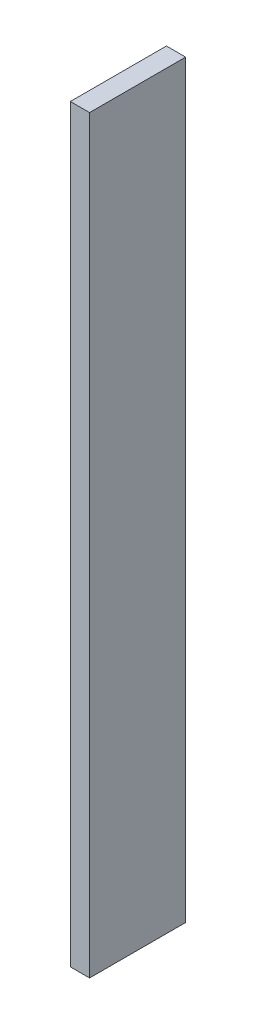
from build123d import *

# Parameters (mm, degrees)
ESQUISSE1_W        = 50
ESQUISSE1_H        = 390
BOSS_EXTRU_1_DEPTH = 10


with BuildPart() as part:
    # Esquisse1 → Boss.-Extru.1 (new body)
    with BuildSketch(Plane(origin=(0, 0, 0), x_dir=(0, 0, -1), z_dir=(1, 0, 0))):
        Rectangle(ESQUISSE1_W, ESQUISSE1_H)
    extrude(amount=BOSS_EXTRU_1_DEPTH)


solid = part.part
